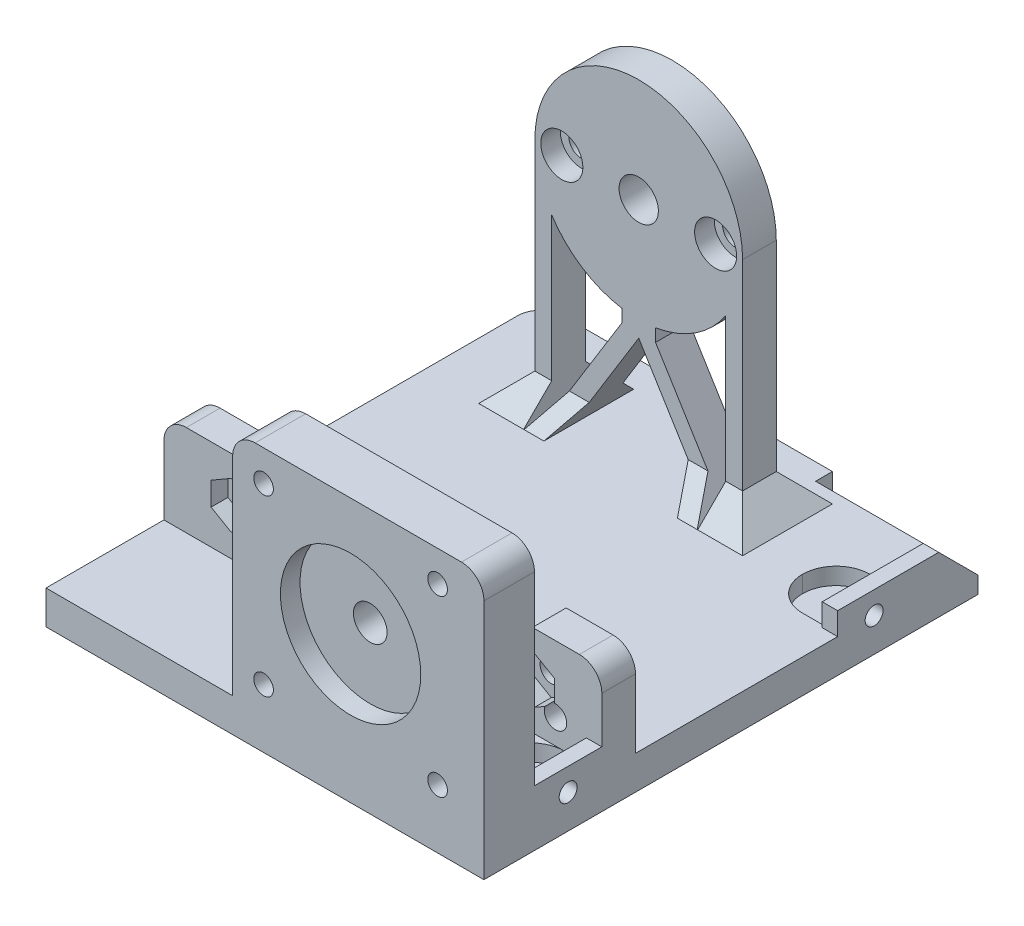
from build123d import *

# Parameters (mm, degrees)
SKETCH1_R           = 18.5
SKETCH1_R_2         = 3.5
SKETCH1_R_3         = 2.25
BOSS_EXTRUDE1_DEPTH = 6
BOSS_EXTRUDE2_START = -6
BOSS_EXTRUDE2_DEPTH = 6
BOSS_EXTRUDE3_DEPTH = 85
SKETCH6_R           = 2
BOSS_EXTRUDE5_DEPTH = 6
SKETCH5_W           = 42
SKETCH5_H           = 41
SKETCH5_R           = 1.75
SKETCH5_R_2         = 3
BOSS_EXTRUDE4_DEPTH = 6
SKETCH8_W           = 25
SKETCH8_H           = 7
BOSS_EXTRUDE7_DEPTH = 2.75
CHAMFER2_SIZE       = 7
SKETCH9_R           = 1.6
CUT_EXTRUDE2_DEPTH  = 10
SKETCH10_W          = 10
SKETCH10_H          = 12
CUT_EXTRUDE3_DEPTH  = 3
FILLET1_R           = 6
SKETCH11_R          = 2.25
SKETCH11_R_2        = 3.5
BOSS_EXTRUDE8_DEPTH = 10
SKETCH13_R          = 2.25
SKETCH13_R_2        = 3.5
CUT_EXTRUDE4_DEPTH  = 10
SKETCH14_R          = 3.75
CUT_EXTRUDE5_DEPTH  = 3.5
CHAMFER4_SIZE       = 5
FILLET2_R           = 4
CUT_EXTRUDE6_DEPTH  = 3
BOSS_EXTRUDE9_START = 3
SKETCH18_R          = 1.75
SKETCH18_R_2        = 3
SKETCH18_W          = 33.25
SKETCH18_H          = 6
BOSS_EXTRUDE9_DEPTH = 3
SKETCH16_R          = 12.5
CUT_EXTRUDE7_DEPTH  = 3.5
SKETCH20_R          = 3
CUT_EXTRUDE8_DEPTH  = 3


# Some blends are built 0.0001 mm under size
with BuildPart() as part:
    # Sketch1 → Boss-Extrude1 (new body)
    with BuildSketch(Plane.XY):
        Circle(SKETCH1_R)
        Circle(SKETCH1_R_2, mode=Mode.SUBTRACT)
        with Locations((-13.7, 0)):
            Circle(SKETCH1_R_3, mode=Mode.SUBTRACT)
        with Locations((13.7, 0)):
            Circle(SKETCH1_R_3, mode=Mode.SUBTRACT)
    extrude(amount=BOSS_EXTRUDE1_DEPTH)

    # Sketch3 → Boss-Extrude2 (add)
    with BuildSketch(Plane.XY.offset(6).offset(BOSS_EXTRUDE2_START)):
        with BuildLine():
            ThreePointArc((-15.5, -10.099504938), (-17.734147851, -5.267826876), (-18.5, 0))
            Line((-18.5, 0), (-18.5, -46.68))
            Line((-18.5, -46.68), (18.5, -46.68))
            Line((18.5, -46.68), (18.5, 0))
            ThreePointArc((18.5, 0), (17.734147851, -5.267826876), (15.5, -10.099504938))
            Line((15.5, -10.099504938), (15.5, -40.818554828))
            Line((15.5, -40.818554828), (15.5, -43.68))
            Line((15.5, -43.68), (13.738586173, -43.68))
            Line((13.738586173, -43.68), (-13.738586173, -43.68))
            Line((-13.738586173, -43.68), (-15.5, -43.68))
            Line((-15.5, -43.68), (-15.5, -40.818554828))
            Line((-15.5, -40.818554828), (-15.5, -10.099504938))
        make_face()
        with BuildLine():
            Line((-3, -20.512103215), (-15.5, -40.818554828))
            Line((-15.5, -40.818554828), (-15.5, -43.68))
            Line((-15.5, -43.68), (-13.738586173, -43.68))
            Line((-13.738586173, -43.68), (0, -21.361445172))
            Line((0, -21.361445172), (13.738586173, -43.68))
            Line((13.738586173, -43.68), (15.5, -43.68))
            Line((15.5, -43.68), (15.5, -40.818554828))
            Line((15.5, -40.818554828), (3, -20.512103215))
            Line((3, -20.512103215), (1.71251735, -18.420566884))
            ThreePointArc((1.71251735, -18.420566884), (0, -18.5), (-1.71251735, -18.420566884))
            Line((-1.71251735, -18.420566884), (-3, -20.512103215))
        make_face()
        with BuildLine():
            Line((3, -20.512103215), (3, -18.255136264))
            ThreePointArc((3, -18.255136264), (2.357710068, -18.349147207), (1.71251735, -18.420566884))
            Line((1.71251735, -18.420566884), (3, -20.512103215))
        make_face()
        with BuildLine():
            ThreePointArc((-1.71251735, -18.420566884), (-2.357710068, -18.349147207), (-3, -18.255136264))
            Line((-3, -18.255136264), (-3, -20.512103215))
            Line((-3, -20.512103215), (-1.71251735, -18.420566884))
        make_face()
    extrude(amount=BOSS_EXTRUDE2_DEPTH)

    # Sketch4 → Boss-Extrude3 (add)
    with BuildSketch(Plane.XY):
        Polygon((-33.57, -46.68), (-33.57, -40.68), (44.43, -40.68), (44.43, -46.68), (-18.5, -46.68), align=None)
    extrude(amount=BOSS_EXTRUDE3_DEPTH)

    # Sketch6 → Boss-Extrude5 (add)
    with BuildSketch(Plane(origin=(0, 0, 67), x_dir=(-1, 0, 0), z_dir=(0, 0, -1))):
        with BuildLine():
            Line((-44.43, -24.43), (-44.43, -43.68))
            Line((-44.43, -43.68), (33.57, -43.68))
            Line((33.57, -43.68), (33.57, -24.43))
            Line((33.57, -24.43), (-9.280986885, -24.43))
            ThreePointArc((-9.280986885, -24.43), (-20.68, -32.68), (-32.079013115, -24.43))
            Line((-32.079013115, -24.43), (-44.43, -24.43))
        make_face()
        with Locations((-36.18, -36.18)):
            Circle(SKETCH6_R, mode=Mode.SUBTRACT)
        with Locations((-32.43, -32.43)):
            Circle(SKETCH6_R, mode=Mode.SUBTRACT)
        with Locations((-5.18, -36.18)):
            Circle(SKETCH6_R, mode=Mode.SUBTRACT)
        with Locations((21.57, -32.43)):
            Circle(SKETCH6_R, mode=Mode.SUBTRACT)
    extrude(amount=BOSS_EXTRUDE5_DEPTH)

    # Sketch5 → Boss-Extrude4 (add)
    with BuildSketch(Plane.XY.offset(85)):
        with Locations((20.68, -20.18)):
            Rectangle(SKETCH5_W, SKETCH5_H)
        with Locations((5.18, -36.18)):
            Circle(SKETCH5_R, mode=Mode.SUBTRACT)
        with Locations((36.18, -36.18)):
            Circle(SKETCH5_R, mode=Mode.SUBTRACT)
        with Locations((5.18, -5.18)):
            Circle(SKETCH5_R, mode=Mode.SUBTRACT)
        with Locations((20.68, -20.68)):
            Circle(SKETCH5_R_2, mode=Mode.SUBTRACT)
        with Locations((36.18, -5.18)):
            Circle(SKETCH5_R, mode=Mode.SUBTRACT)
    extrude(amount=-BOSS_EXTRUDE4_DEPTH)

    # Sketch8 → Boss-Extrude7 (add)
    with BuildSketch(Plane(origin=(44.43, 0, 0), x_dir=(0, 0, -1), z_dir=(1, 0, 0))):
        with Locations((-12.5, -40.18)):
            Rectangle(SKETCH8_W, SKETCH8_H)
        Polygon((-61, -36.68), (-79, -36.68), (-79, 0.32), (-85, 0.32), (-85, -43.68), (-61, -43.68), align=None)
    extrude(amount=-BOSS_EXTRUDE7_DEPTH)

    # Chamfer2
    # the kernel refuses this chamfer: 7 mm, written as the material it takes off along each edge
    with BuildSketch(Plane(origin=(62.431780916, -36.68, 0), x_dir=(0, 0, 1), z_dir=(-1, 0, 0))) as chamfer2_piece_1:
        Polygon((CHAMFER2_SIZE, 0), (0, -CHAMFER2_SIZE), (0, 0), align=None)
    extrude(amount=38.753561832, mode=Mode.SUBTRACT)
    # the kernel refuses this chamfer: 7 mm, written as the material it takes off along each edge
    with BuildSketch(Plane(origin=(18.5, -40.68, 0), x_dir=(0, -1, 0), z_dir=(1, 0, 0))) as chamfer2_2_piece_1_section:
        Polygon((CHAMFER2_SIZE, 0), (0, -CHAMFER2_SIZE), (0, 0), align=None)
    chamfer2_2_piece_1 = extrude(amount=23.18, mode=Mode.PRIVATE)
    chamfer2_2_piece_1 = split(chamfer2_2_piece_1, bisect_by=Plane(origin=(18.5, -42.18, 1.5), z_dir=(0, 0.7071067811865476, -0.7071067811865476)), keep=Keep.TOP, mode=Mode.PRIVATE)
    add(chamfer2_2_piece_1, mode=Mode.SUBTRACT)

    # Sketch9 → Cut-Extrude2 (cut)
    with BuildSketch(Plane(origin=(44.43, 0, 0), x_dir=(0, 0, -1), z_dir=(1, 0, 0))):
        with Locations((-73, -40.68)):
            Circle(SKETCH9_R)
        with Locations((-18.5, -40.68)):
            Circle(SKETCH9_R)
    extrude(amount=-CUT_EXTRUDE2_DEPTH, mode=Mode.SUBTRACT)

    # Sketch10 → Cut-Extrude3 (cut)
    with BuildSketch(Plane(origin=(0, -40.68, 0), x_dir=(1, 0, 0), z_dir=(0, 1, 0))):
        with Locations((36.68, -18.5)):
            Rectangle(SKETCH10_W, SKETCH10_H)
        with Locations((36.68, -73)):
            Rectangle(SKETCH10_W, SKETCH10_H)
    extrude(amount=-CUT_EXTRUDE3_DEPTH, mode=Mode.SUBTRACT)

    # Fillet1
    fillet1_edges = [part.edges().sort_by_distance(p)[0] for p in [
        (31.68, -42.18, 67),
        (31.68, -42.18, 79),
        (31.68, -42.18, 24.5),
        (31.68, -42.18, 12.5),
    ]]
    fillet(fillet1_edges, radius=FILLET1_R - 0.0001)  # a hair under: the kernel refuses the full size

    # Sketch11 → Boss-Extrude8 (add)
    with BuildSketch(Plane.XY.offset(6)):
        with BuildLine():
            Line((-15.5, -40.68), (-15.5, -10.099504938))
            ThreePointArc((-15.5, -10.099504938), (-10.10896041, -15.493834884), (-3, -18.255136264))
            Line((-3, -18.255136264), (-3, -20.512103215))
            Line((-3, -20.512103215), (-15.414710094, -40.68))
            Line((-15.414710094, -40.68), (-11.89188244, -40.68))
            Line((-11.89188244, -40.68), (0, -21.361445172))
            Line((0, -21.361445172), (11.89188244, -40.68))
            Line((11.89188244, -40.68), (15.414710094, -40.68))
            Line((15.414710094, -40.68), (3, -20.512103215))
            Line((3, -20.512103215), (3, -18.255136264))
            ThreePointArc((3, -18.255136264), (10.10896041, -15.493834884), (15.5, -10.099504938))
            Line((15.5, -10.099504938), (15.5, -40.68))
            Line((15.5, -40.68), (18.5, -40.68))
            Line((18.5, -40.68), (18.5, 0))
            ThreePointArc((18.5, 0), (0, 18.5), (-18.5, 0))
            Line((-18.5, 0), (-18.5, -40.68))
            Line((-18.5, -40.68), (-15.5, -40.68))
        make_face()
        with Locations((13.7, 0)):
            Circle(SKETCH11_R, mode=Mode.SUBTRACT)
        with Locations((-13.7, 0)):
            Circle(SKETCH11_R, mode=Mode.SUBTRACT)
        Circle(SKETCH11_R_2, mode=Mode.SUBTRACT)
    extrude(amount=BOSS_EXTRUDE8_DEPTH)

    # Sketch13 → Cut-Extrude4 (cut)
    # profile 1 of 4: a face of its own
    with BuildSketch(Plane(origin=(0, 0, 0), x_dir=(-1, 0, 0), z_dir=(0, 0, -1))):
        with BuildLine():
            ThreePointArc((3, -18.255136264), (0, -18.5), (-3, -18.255136264))
            Line((-3, -18.255136264), (-3, -20.512103215))
            Line((-3, -20.512103215), (-15.414710094, -40.68))
            Line((-15.414710094, -40.68), (-11.89188244, -40.68))
            Line((-11.89188244, -40.68), (0, -21.361445172))
            Line((0, -21.361445172), (11.89188244, -40.68))
            Line((11.89188244, -40.68), (15.414710094, -40.68))
            Line((15.414710094, -40.68), (3, -20.512103215))
            Line((3, -20.512103215), (3, -18.255136264))
        make_face()
    # profile 2 of 4: a face of its own
    with BuildSketch(Plane(origin=(0, 0, 0), x_dir=(-1, 0, 0), z_dir=(0, 0, -1))):
        with BuildLine():
            ThreePointArc((-15.5, -10.099504938), (-17.734147851, -5.267826876), (-18.5, 0))
            Line((-18.5, 0), (-18.5, -40.68))
            Line((-18.5, -40.68), (-15.5, -40.68))
            Line((-15.5, -40.68), (-15.5, -10.099504938))
        make_face()
    # profile 3 of 4: a face of its own
    with BuildSketch(Plane(origin=(0, 0, 0), x_dir=(-1, 0, 0), z_dir=(0, 0, -1))):
        with BuildLine():
            Line((18.5, -40.68), (18.5, 0))
            ThreePointArc((18.5, 0), (17.734147851, -5.267826876), (15.5, -10.099504938))
            Line((15.5, -10.099504938), (15.5, -40.68))
            Line((15.5, -40.68), (18.5, -40.68))
        make_face()
    # profile 4 of 4: a face of its own
    with BuildSketch(Plane(origin=(0, 0, 0), x_dir=(-1, 0, 0), z_dir=(0, 0, -1))):
        with BuildLine():
            ThreePointArc((18.5, 0), (0, 18.5), (-18.5, 0))
            ThreePointArc((-18.5, 0), (-17.734147851, -5.267826876), (-15.5, -10.099504938))
            ThreePointArc((-15.5, -10.099504938), (-10.10896041, -15.493834884), (-3, -18.255136264))
            ThreePointArc((-3, -18.255136264), (0, -18.5), (3, -18.255136264))
            ThreePointArc((3, -18.255136264), (10.10896041, -15.493834884), (15.5, -10.099504938))
            ThreePointArc((15.5, -10.099504938), (17.734147851, -5.267826876), (18.5, 0))
        make_face()
        with Locations((-13.7, 0)):
            Circle(SKETCH13_R, mode=Mode.SUBTRACT)
        Circle(SKETCH13_R_2, mode=Mode.SUBTRACT)
        with Locations((13.7, 0)):
            Circle(SKETCH13_R, mode=Mode.SUBTRACT)
    extrude(amount=-CUT_EXTRUDE4_DEPTH, mode=Mode.SUBTRACT)

    # Sketch14 → Cut-Extrude5 (cut)
    with BuildSketch(Plane.XY.offset(16)):
        with Locations((-13.7, 0)):
            Circle(SKETCH14_R)
        with Locations((13.7, 0)):
            Circle(SKETCH14_R)
    extrude(amount=-CUT_EXTRUDE5_DEPTH, mode=Mode.SUBTRACT)

    # Chamfer4
    chamfer4_edges = [part.edges().sort_by_distance(p)[0] for p in [
        (-17, -40.68, 16),
        (-13.653296267, -40.68, 16),
        (13.653296267, -40.68, 16),
        (17, -40.68, 16),
        (-18.5, -40.68, 13),
        (18.5, -40.68, 13),
        (-13.653296267, -40.68, 10),
        (13.653296267, -40.68, 10),
        (17, -40.68, 10),
        (-17, -40.68, 10),
    ]]
    chamfer(chamfer4_edges, length=CHAMFER4_SIZE)

    # Fillet2
    fillet2_edges = [part.edges().sort_by_distance(p)[0] for p in [
        (44.43, -24.43, 64),
        (-33.57, -24.43, 64),
        (-0.32, 0.32, 82),
        (44.43, 0.32, 82),
        (-33.57, -43.68, 0),
    ]]
    fillet(fillet2_edges, radius=FILLET2_R)

    # Sketch15 → Cut-Extrude6 (cut)
    with BuildSketch(Plane.XY.offset(67)):
        Polygon((-21.57, -28.273078062), (-25.17, -30.351539031), (-25.17, -34.508460969), (-21.57, -36.586921938), (-17.97, -34.508460969), (-17.97, -30.351539031), align=None)
        Polygon((32.43, -28.273078062), (28.83, -30.351539031), (28.83, -34.508460969), (32.43, -36.586921938), (36.03, -34.508460969), (36.03, -30.351539031), align=None)
    extrude(amount=-CUT_EXTRUDE6_DEPTH, mode=Mode.SUBTRACT)

    # Sketch18 → Boss-Extrude9 (add)
    # profile 1 of 2: a face of its own
    with BuildSketch(Plane.XY.offset(85).offset(BOSS_EXTRUDE9_START)):
        with BuildLine():
            ThreePointArc((44.43, -3.68), (43.258427125, -0.851572875), (40.43, 0.32))
            Line((40.43, 0.32), (3.68, 0.32))
            ThreePointArc((3.68, 0.32), (0.851572875, -0.851572875), (-0.32, -3.68))
            Line((-0.32, -3.68), (-0.32, -40.68))
            Line((-0.32, -40.68), (-0.32, -46.68))
            Line((-0.32, -46.68), (44.43, -46.68))
            Line((44.43, -46.68), (44.43, -3.68))
        make_face()
        with Locations((5.18, -36.18)):
            Circle(SKETCH18_R, mode=Mode.SUBTRACT)
        with Locations((36.18, -36.18)):
            Circle(SKETCH18_R, mode=Mode.SUBTRACT)
        with Locations((5.18, -5.18)):
            Circle(SKETCH18_R, mode=Mode.SUBTRACT)
        with Locations((20.68, -20.68)):
            Circle(SKETCH18_R_2, mode=Mode.SUBTRACT)
        with Locations((36.18, -5.18)):
            Circle(SKETCH18_R, mode=Mode.SUBTRACT)
    # profile 2 of 2: a face of its own
    with BuildSketch(Plane.XY.offset(85).offset(BOSS_EXTRUDE9_START)):
        with Locations((-16.945, -43.68)):
            Rectangle(SKETCH18_W, SKETCH18_H)
    extrude(amount=-BOSS_EXTRUDE9_DEPTH)

    # Sketch16 → Cut-Extrude7 (cut)
    with BuildSketch(Plane.XY.offset(88)):
        with Locations((20.68, -20.68)):
            Circle(SKETCH16_R)
    extrude(amount=-CUT_EXTRUDE7_DEPTH, mode=Mode.SUBTRACT)

    # Sketch20 → Cut-Extrude8 (cut)
    with BuildSketch(Plane(origin=(0, 0, 79), x_dir=(-1, 0, 0), z_dir=(0, 0, -1))):
        with Locations((-36.18, -5.18)):
            Circle(SKETCH20_R)
        with Locations((-5.18, -5.18)):
            Circle(SKETCH20_R)
        with Locations((-5.18, -36.18)):
            Circle(SKETCH20_R)
        with Locations((-36.18, -36.18)):
            Circle(SKETCH20_R)
    extrude(amount=-CUT_EXTRUDE8_DEPTH, mode=Mode.SUBTRACT)


solid = part.part
